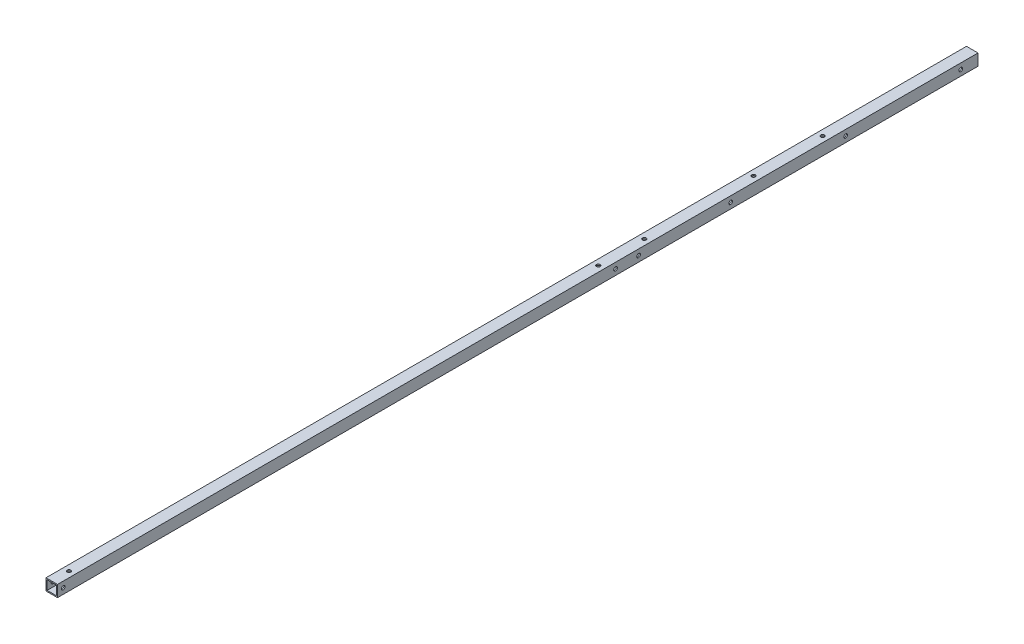
from build123d import *

# Parameters (mm, degrees)
SKETCH_1_W             = 10
SKETCH_1_H             = 10
SKETCH_1_W_2           = 8
SKETCH_1_H_2           = 8
EXTRUDE_1_DEPTH        = 800
SKETCH_3_R             = 1.6
CUT_EXTRUDE_2_DEPTH    = 801.078121186
SKETCH_4_R             = 1.6
CUT_EXTRUDE_3_DEPTH    = 801.078121186
SKETCH_5_R             = 1.6
CUT_EXTRUDE_4_DEPTH    = 801.078121186
PATTERN_LINEAR_1_COUNT = 4
PATTERN_LINEAR_1_PITCH = 100


with BuildPart() as part:
    # ｽｹｯﾁ1 → ﾎﾞｽ - 押し出し1 (new body)
    with BuildSketch(Plane.XY):
        Rectangle(SKETCH_1_W, SKETCH_1_H)
        Rectangle(SKETCH_1_W_2, SKETCH_1_H_2, mode=Mode.SUBTRACT)
    extrude(amount=EXTRUDE_1_DEPTH)

    # ｽｹｯﾁ3 → ｶｯﾄ - 押し出し2 (cut, through all)
    with BuildSketch(Plane(origin=(0, 5, 0), x_dir=(1, 0, 0), z_dir=(0, 1, 0))):
        with Locations((0, -785)):
            Circle(SKETCH_3_R)
        with Locations((0, -190)):
            Circle(SKETCH_3_R)
        with Locations((0, -130)):
            Circle(SKETCH_3_R)
        with Locations((0, -325)):
            Circle(SKETCH_3_R)
        with Locations((0, -285)):
            Circle(SKETCH_3_R)
    extrude(amount=-CUT_EXTRUDE_2_DEPTH, mode=Mode.SUBTRACT)

    # ｽｹｯﾁ4 → ｶｯﾄ - 押し出し3 (cut, through all)
    with BuildSketch(Plane.ZY.offset(5)):
        with Locations((795, 0)):
            Circle(SKETCH_4_R)
        with Locations((295, 0)):
            Circle(SKETCH_4_R)
    extrude(amount=-CUT_EXTRUDE_3_DEPTH, mode=Mode.SUBTRACT)

    # ｽｹｯﾁ5 → ｶｯﾄ - 押し出し4 (cut, through all)
    with BuildSketch(Plane(origin=(5, 0, 0), x_dir=(0, 0, -1), z_dir=(1, 0, 0))):
        with Locations((-15, 0)):
            Circle(SKETCH_5_R)
    cut_extrude_4 = extrude(amount=-CUT_EXTRUDE_4_DEPTH, mode=Mode.SUBTRACT)

    # 直線ﾊﾟﾀｰﾝ1: ｶｯﾄ - 押し出し4 ×4
    with Locations(*[(0, 0, i * PATTERN_LINEAR_1_PITCH) for i in range(1, PATTERN_LINEAR_1_COUNT)]):
        add(cut_extrude_4, mode=Mode.SUBTRACT)


solid = part.part
